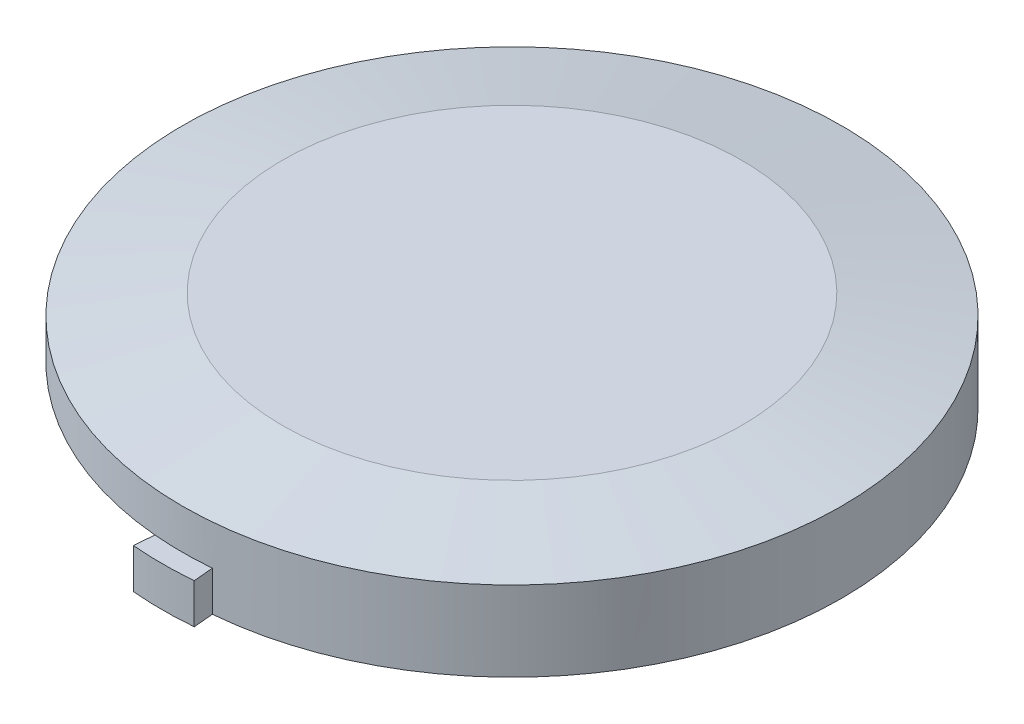
from build123d import *

# Parameters (mm, degrees)
SKETCH1_R                    = 16.5
BOSS_EXTRUDE1_DEPTH          = 5
CHAMFER2_SIZE                = 1
CHAMFER2_SIZE2               = 5
SKETCH3_R                    = 13.5
CUT_EXTRUDE1_DEPTH           = 2.78
SKETCH5_W                    = 1
SKETCH5_H                    = 2
REVOLVE4_ANGLE               = 5
REVOLVE4_OTHER_WAY_ANGLE     = 5
REVOLVE6_DEPTH               = 2
SKETCH9_W                    = 16.5
SKETCH9_H                    = 2
CUT_REVOLVE1_ANGLE           = 85
CUT_REVOLVE1_OTHER_WAY_ANGLE = 10


# Read off the part's stored shape, not the designer's step: Revolve6
with BuildPart() as part:
    # Sketch1 → Boss-Extrude1 (new body)
    with BuildSketch(Plane(origin=(0, 0, 0), x_dir=(1, 0, 0), z_dir=(0, 1, 0))):
        with Locations(Location((0, 0, 0), (0, 0, 270))):
            Circle(SKETCH1_R)
    extrude(amount=BOSS_EXTRUDE1_DEPTH)

    # Chamfer2
    chamfer2_edges = [part.edges().sort_by_distance(p)[0] for p in [
        (0, 5, -16.5),
    ]]
    chamfer2_side = [part.faces().sort_by_distance(p)[0] for p in [
        (0, 2.5, -16.5),
    ]]
    chamfer(chamfer2_edges, length=CHAMFER2_SIZE, length2=CHAMFER2_SIZE2, reference=chamfer2_side[0])

    # Sketch3 → Cut-Extrude1 (cut)
    with BuildSketch(Plane(origin=(0, 0, 0), x_dir=(1, 0, 0), z_dir=(0, 1, 0))):
        with Locations(Location((0, 0, 0), (0, 0, 270))):
            Circle(SKETCH3_R)
    extrude(amount=CUT_EXTRUDE1_DEPTH, mode=Mode.SUBTRACT)

    # Sketch5 → Revolve4 (revolve)
    with BuildSketch(Plane(origin=(0, 0, 0), x_dir=(0, 0, -1), z_dir=(1, 0, 0))):
        with Locations((17, 1)):
            Rectangle(SKETCH5_W, SKETCH5_H)
    revolve(axis=Axis((0, 0, 0), (0, 1, 0)), revolution_arc=REVOLVE4_ANGLE)

    # Sketch5 → Revolve4 other way (revolve)
    with BuildSketch(Plane(origin=(0, 0, 0), x_dir=(0, 0, -1), z_dir=(1, 0, 0))):
        with Locations((17, 1)):
            Rectangle(SKETCH5_W, SKETCH5_H)
    revolve(axis=Axis((0, 0, 0), (0, -1, 0)), revolution_arc=REVOLVE4_OTHER_WAY_ANGLE)

    # Revolve6 outline → Revolve6 (add)
    with BuildSketch(Plane(origin=(0, 0, 0), x_dir=(1, 0, 0), z_dir=(0, 1, 0))):
        with BuildLine():
            ThreePointArc((-1.525225498, -17.433407217), (0, -17.5), (1.525225498, -17.433407217))
            Line((1.525225498, -17.433407217), (1.438069755, -16.437212519))
            ThreePointArc((1.438069755, -16.437212519), (0, -16.5), (-1.438069755, -16.437212519))
            Line((-1.438069755, -16.437212519), (-1.525225498, -17.433407217))
        make_face()
    extrude(amount=REVOLVE6_DEPTH)

    # Sketch9 → Cut-Revolve1 (revolve, cut)
    with BuildSketch(Plane.XY):
        with Locations((-8.25, 1)):
            Rectangle(SKETCH9_W, SKETCH9_H)
    revolve(axis=Axis((0, 0, 0), (0, 1, 0)), revolution_arc=CUT_REVOLVE1_ANGLE, mode=Mode.SUBTRACT)

    # Sketch9 → Cut-Revolve1 other way (revolve, cut)
    with BuildSketch(Plane.XY):
        with Locations((-8.25, 1)):
            Rectangle(SKETCH9_W, SKETCH9_H)
    revolve(axis=Axis((0, 0, 0), (0, -1, 0)), revolution_arc=CUT_REVOLVE1_OTHER_WAY_ANGLE, mode=Mode.SUBTRACT)


solid = part.part
